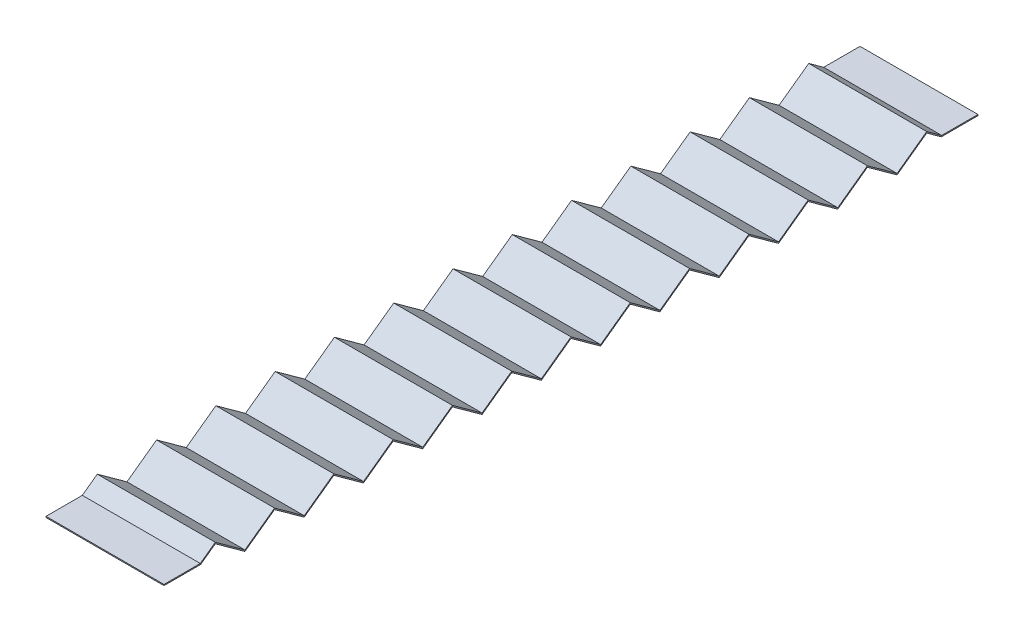
from build123d import *

# Parameters (mm, degrees)
EXTRUDE_THIN1_DEPTH = 27.5


with BuildPart() as part:
    # Sketch3 → Extrude-Thin1 (new, symmetric)
    with BuildSketch(Plane(origin=(0, 0, 0), x_dir=(0, 0, -1), z_dir=(1, 0, 0))):
        Polygon((0, 4.75), (17.08097596, 4.75), (23.908580556, 9.691394648), (37.725741668, -0.308605352), (51.542902779, 9.691394648), (65.360063891, -0.308605352), (79.177225003, 9.691394648), (92.994386114, -0.308605352), (106.811547226, 9.691394648), (120.628708338, -0.308605352), (134.44586945, 9.691394648), (148.263030561, -0.308605352), (162.080191673, 9.691394648), (175.897352785, -0.308605352), (189.714513897, 9.691394648), (203.531675008, -0.308605352), (217.34883612, 9.691394648), (231.165997232, -0.308605352), (244.983158343, 9.691394648), (258.800319455, -0.308605352), (272.617480567, 9.691394648), (286.434641679, -0.308605352), (300.25180279, 9.691394648), (314.068963902, -0.308605352), (327.886125014, 9.691394648), (341.703286125, -0.308605352), (355.520447237, 9.691394648), (362.348051834, 4.75), (379.429027793, 4.75), (379.429027793, 5.25), (362.510003753, 5.25), (355.520447237, 10.308605352), (341.703286125, 0.308605352), (327.886125014, 10.308605352), (314.068963902, 0.308605352), (300.25180279, 10.308605352), (286.434641679, 0.308605352), (272.617480567, 10.308605352), (258.800319455, 0.308605352), (244.983158343, 10.308605352), (231.165997232, 0.308605352), (217.34883612, 10.308605352), (203.531675008, 0.308605352), (189.714513897, 10.308605352), (175.897352785, 0.308605352), (162.080191673, 10.308605352), (148.263030561, 0.308605352), (134.44586945, 10.308605352), (120.628708338, 0.308605352), (106.811547226, 10.308605352), (92.994386114, 0.308605352), (79.177225003, 10.308605352), (65.360063891, 0.308605352), (51.542902779, 10.308605352), (37.725741668, 0.308605352), (23.908580556, 10.308605352), (16.91902404, 5.25), (0, 5.25), align=None)
    extrude(amount=EXTRUDE_THIN1_DEPTH, both=True)


solid = part.part
